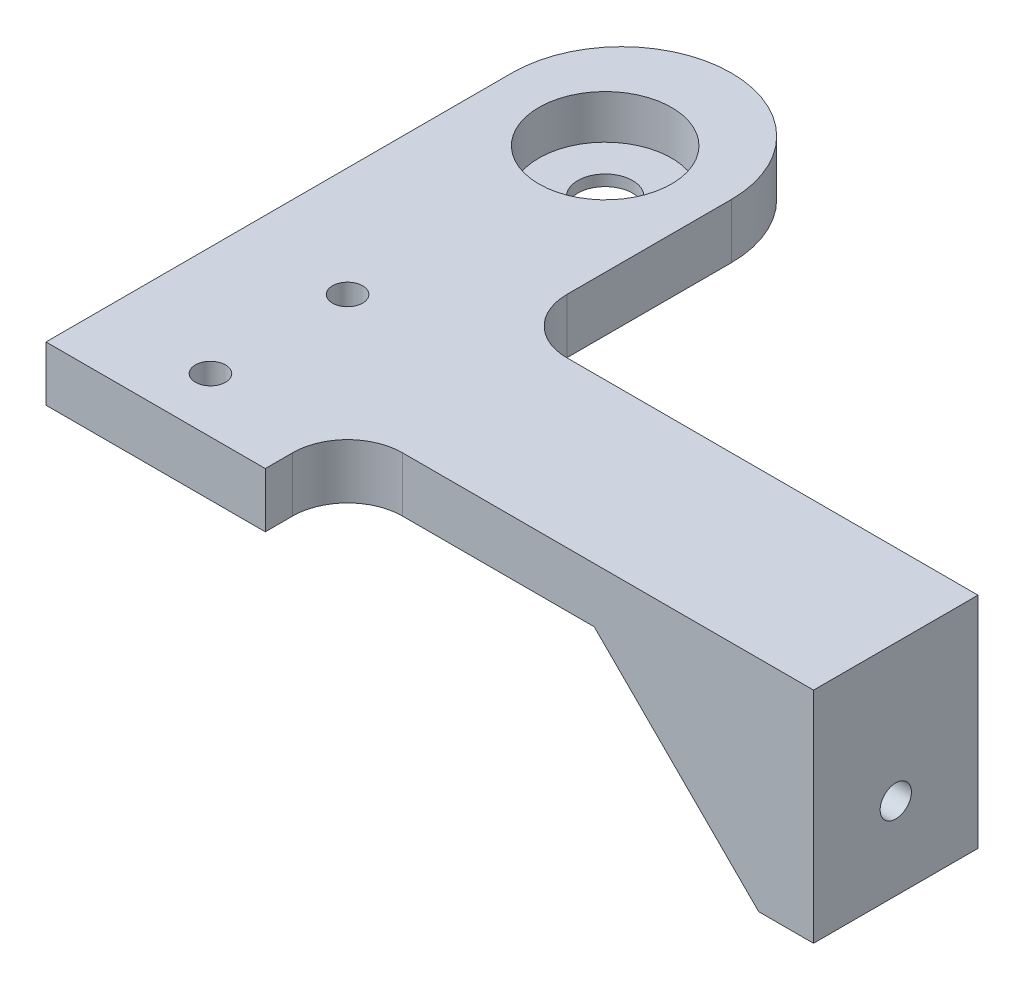
from build123d import *

# Parameters (mm, degrees)
SKETCH1_R           = 2.75
SKETCH1_R_2         = 12.1
BOSS_EXTRUDE1_DEPTH = 8
BOSS_EXTRUDE5_START = 2
SKETCH7_R           = 5
SKETCH7_R_2         = 2.75
BOSS_EXTRUDE5_DEPTH = 2
BOSS_EXTRUDE6_DEPTH = 15
SKETCH9_R           = 2.85
CUT_EXTRUDE2_DEPTH  = 40
FILLET2_R           = 10
BOSS_EXTRUDE7_DEPTH = 5
CHAMFER1_SIZE       = 2.5


with BuildPart() as part:
    # Sketch1 → Boss-Extrude1 (new body)
    with BuildSketch(Plane(origin=(0, 0, 0), x_dir=(1, 0, 0), z_dir=(0, 1, 0))):
        with BuildLine():
            Line((-20, 0), (20, 0))
            Line((20, 0), (20, 85))
            ThreePointArc((20, 85), (0, 105), (-20, 85))
            Line((-20, 85), (-20, 0))
        make_face()
        with Locations((0, 10)):
            Circle(SKETCH1_R, mode=Mode.SUBTRACT)
        with Locations((0, 82)):
            Circle(SKETCH1_R_2, mode=Mode.SUBTRACT)
        with Locations((0, 35)):
            Circle(SKETCH1_R, mode=Mode.SUBTRACT)
    extrude(amount=BOSS_EXTRUDE1_DEPTH)

    # Sketch7 → Boss-Extrude5 (add)
    with BuildSketch(Plane.XZ.offset(BOSS_EXTRUDE5_START)):
        with BuildLine():
            Line((20, 0), (20, -85))
            ThreePointArc((20, -85), (0, -105), (-20, -85))
            Line((-20, -85), (-20, 0))
            Line((-20, 0), (20, 0))
        make_face()
        with Locations((0, -82)):
            Circle(SKETCH7_R, mode=Mode.SUBTRACT)
        with Locations((0, -10)):
            Circle(SKETCH7_R_2, mode=Mode.SUBTRACT)
        with Locations((0, -35)):
            Circle(SKETCH7_R_2, mode=Mode.SUBTRACT)
    extrude(amount=-BOSS_EXTRUDE5_DEPTH)

    # Sketch8 → Boss-Extrude6 (add, symmetric)
    with BuildSketch(Plane.XY.offset(-30)):
        Polygon((105, 8), (20, 8), (20, -2), (91.464466094, -2), (95, -5.535533906), (95, -32), (105, -32), align=None)
    extrude(amount=BOSS_EXTRUDE6_DEPTH, both=True)

    # Sketch9 → Cut-Extrude2 (cut)
    with BuildSketch(Plane(origin=(105, 0, 0), x_dir=(0, 0, -1), z_dir=(1, 0, 0))):
        with Locations((30, -17)):
            Circle(SKETCH9_R)
    extrude(amount=-CUT_EXTRUDE2_DEPTH, mode=Mode.SUBTRACT)

    # Fillet2
    fillet2_edges = [part.edges().sort_by_distance(p)[0] for p in [
        (20, 3, -15),
        (20, 3, -45),
    ]]
    fillet(fillet2_edges, radius=FILLET2_R)

    # Sketch10 → Boss-Extrude7 (add)
    with BuildSketch(Plane(origin=(0, 0, -45), x_dir=(-1, 0, 0), z_dir=(0, 0, -1))):
        Polygon((-95, -32), (-95, -2), (-65, -2), align=None)
    boss_extrude7 = extrude(amount=-BOSS_EXTRUDE7_DEPTH)

    # Mirror1: Boss-Extrude7 across plane
    add(boss_extrude7.mirror(Plane.XY.offset(-30)))

    # Chamfer1
    chamfer1_edges = [part.edges().sort_by_distance(p)[0] for p in [
        (-2.75, -2, -10),
        (-2.75, -2, -35),
    ]]
    chamfer(chamfer1_edges, length=CHAMFER1_SIZE)


solid = part.part
